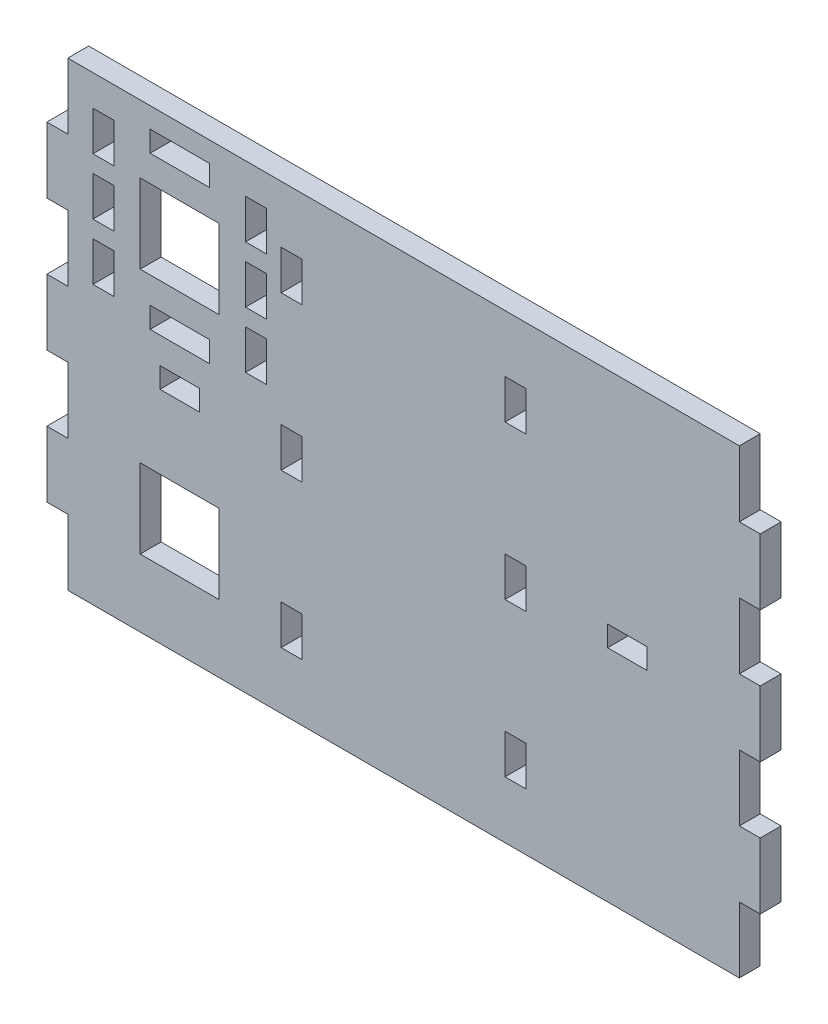
from build123d import *

# Parameters (mm, degrees)
SKETCH1_W           = 12
SKETCH1_H           = 12
SKETCH1_W_2         = 6
SKETCH1_H_2         = 3.125
SKETCH1_W_3         = 9
SKETCH1_H_3         = 3.175
SKETCH1_W_4         = 3.175
SKETCH1_H_4         = 6
BOSS_EXTRUDE1_DEPTH = 1.5875


with BuildPart() as part:
    # Sketch1 → Boss-Extrude1 (new, symmetric)
    with BuildSketch(Plane.XY):
        Polygon((54.175, 0), (54.175, 5), (51, 5), (51, 15), (54.175, 15), (54.175, 25), (51, 25), (51, 35), (-51, 35), (-51, 25), (-54.175, 25), (-54.175, 15), (-51, 15), (-51, 5), (-54.175, 5), (-54.175, -5), (-51, -5), (-51, -15), (-54.175, -15), (-54.175, -25), (-51, -25), (-51, -35), (51, -35), (51, -25), (54.175, -25), (54.175, -15), (51, -15), (51, -5), (54.175, -5), align=None)
        with Locations((-34, -18.7375)):
            Rectangle(SKETCH1_W, SKETCH1_H, mode=Mode.SUBTRACT)
        with Locations((-34, 0)):
            Rectangle(SKETCH1_W_2, SKETCH1_H_2, mode=Mode.SUBTRACT)
        with Locations((-34, 7.15)):
            Rectangle(SKETCH1_W_3, SKETCH1_H_3, mode=Mode.SUBTRACT)
        with Locations((-34, 18.7375)):
            Rectangle(SKETCH1_W, SKETCH1_H, mode=Mode.SUBTRACT)
        with Locations((-34, 30.325)):
            Rectangle(SKETCH1_W_3, SKETCH1_H_3, mode=Mode.SUBTRACT)
        with Locations((-17, -23.333333333)):
            Rectangle(SKETCH1_W_4, SKETCH1_H_4, mode=Mode.SUBTRACT)
        with Locations((17, -23.333333333)):
            Rectangle(SKETCH1_W_4, SKETCH1_H_4, mode=Mode.SUBTRACT)
        with Locations((-17, 0)):
            Rectangle(SKETCH1_W_4, SKETCH1_H_4, mode=Mode.SUBTRACT)
        with Locations((-22.4125, 10.15)):
            Rectangle(SKETCH1_W_4, SKETCH1_H_4, mode=Mode.SUBTRACT)
        with Locations((-22.4125, 18.7375)):
            Rectangle(SKETCH1_W_4, SKETCH1_H_4, mode=Mode.SUBTRACT)
        with Locations((-17, 23.333333333)):
            Rectangle(SKETCH1_W_4, SKETCH1_H_4, mode=Mode.SUBTRACT)
        with Locations((-22.4125, 27.325)):
            Rectangle(SKETCH1_W_4, SKETCH1_H_4, mode=Mode.SUBTRACT)
        with Locations((17, 0)):
            Rectangle(SKETCH1_W_4, SKETCH1_H_4, mode=Mode.SUBTRACT)
        Polygon((37, 1.5625), (37, 0), (37, -1.5625), (31, -1.5625), (31, 1.5625), align=None, mode=Mode.SUBTRACT)
        with Locations((17, 23.333333333)):
            Rectangle(SKETCH1_W_4, SKETCH1_H_4, mode=Mode.SUBTRACT)
        with Locations((-45.5875, 18.7375)):
            Rectangle(SKETCH1_W_4, SKETCH1_H_4, mode=Mode.SUBTRACT)
        with Locations((-45.5875, 27.325)):
            Rectangle(SKETCH1_W_4, SKETCH1_H_4, mode=Mode.SUBTRACT)
        with Locations((-45.5875, 10.15)):
            Rectangle(SKETCH1_W_4, SKETCH1_H_4, mode=Mode.SUBTRACT)
    extrude(amount=BOSS_EXTRUDE1_DEPTH, both=True)


solid = part.part
